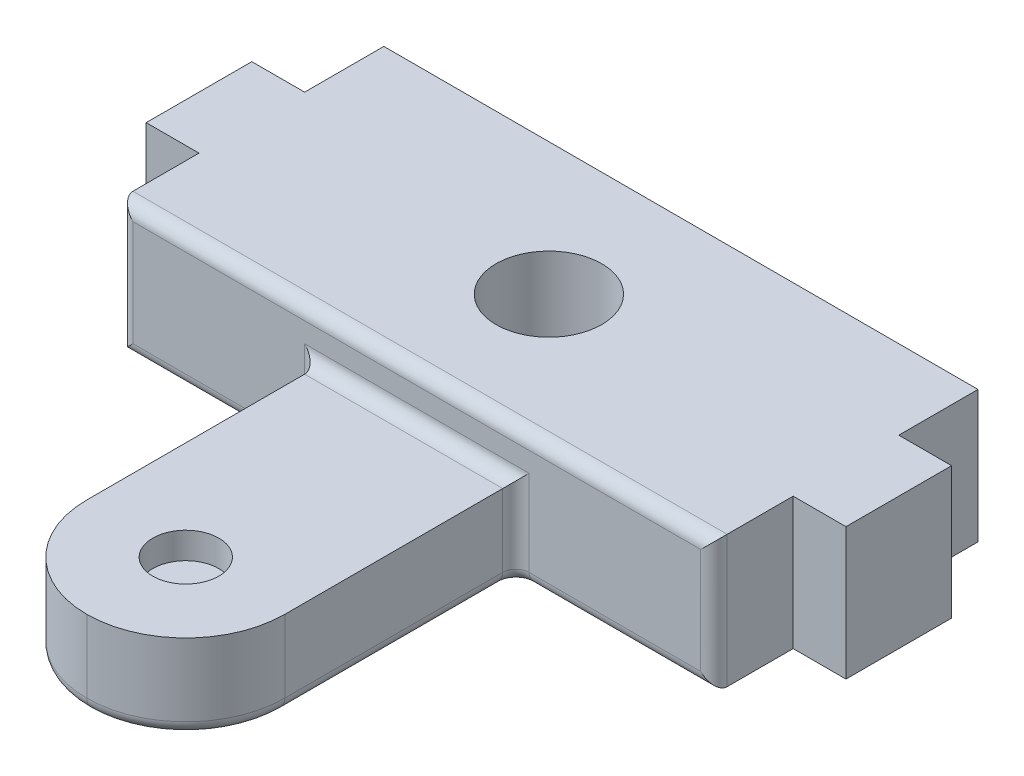
from build123d import *

# Parameters (mm, degrees)
AUFSATZ_LINEAR_AUSTRAGEN1_DEPTH      = 50
AUFSATZ_LINEAR_AUSTRAGEN1_DEPTH_BACK = 50
SKIZZE4_R                            = 40
SCHNITT_LINEAR_AUSTRAGEN1_DEPTH      = 100
SKIZZE5_W                            = 150
SKIZZE5_H                            = 100
AUFSATZ_LINEAR_AUSTRAGEN2_DEPTH      = 250
VERRUNDUNG2_R                        = 75
SCHNITT_LINEAR_AUSTRAGEN3_REACH      = 492.51
SKIZZE8_W                            = 120
SKIZZE8_H                            = 35
SKIZZE9_R                            = 25
SCHNITT_LINEAR_AUSTRAGEN4_DEPTH      = 20
SKIZZE10_W                           = 150
SKIZZE10_H                           = 130
SCHNITT_LINEAR_AUSTRAGEN5_DEPTH      = 35
VERRUNDUNG3_R                        = 10


with BuildPart() as part:
    # Skizze3 → Aufsatz-Linear austragen1 (new, two sides: drawn at the far end of the back side and taken through both)
    with BuildSketch(Plane(origin=(0, 0, 0), x_dir=(1, 0, 0), z_dir=(0, 1, 0)).offset(-AUFSATZ_LINEAR_AUSTRAGEN1_DEPTH_BACK)):
        Polygon((-265, -40), (-265, 40), (-225, 40), (-225, 100), (225, 100), (225, 40), (265, 40), (265, -40), (225, -40), (225, -100), (-225, -100), (-225, -40), align=None)
    extrude(amount=AUFSATZ_LINEAR_AUSTRAGEN1_DEPTH + AUFSATZ_LINEAR_AUSTRAGEN1_DEPTH_BACK)

    # Skizze4 → Schnitt-Linear austragen1 (cut)
    with BuildSketch(Plane(origin=(0, 50, 0), x_dir=(1, 0, 0), z_dir=(0, 1, 0))):
        with Locations(Location((0, 0, 0), (0, 0, 270))):
            Circle(SKIZZE4_R)
    extrude(amount=-SCHNITT_LINEAR_AUSTRAGEN1_DEPTH, mode=Mode.SUBTRACT)

    # Skizze5 → Aufsatz-Linear austragen2 (add)
    with BuildSketch(Plane.XY.offset(100)):
        Rectangle(SKIZZE5_W, SKIZZE5_H)
    extrude(amount=AUFSATZ_LINEAR_AUSTRAGEN2_DEPTH)

    # Verrundung2
    verrundung2_edges = [part.edges().sort_by_distance(p)[0] for p in [
        (-75, 0, 350),
        (75, 0, 350),
    ]]
    fillet(verrundung2_edges, radius=VERRUNDUNG2_R - 0.0001)  # a hair under: the kernel refuses the full size

    # Schnitt-Linear austragen3: up to this face of the body (flat: up to its plane)
    schnitt_linear_austragen3_end = Plane(part.part.faces().sort_by_distance((-75, 0, 187.50005))[0])
    # Skizze8 → Schnitt-Linear austragen3 (cut, up to the picked face)
    with BuildSketch(Plane(origin=(75, 0, 0), x_dir=(0, 0, -1), z_dir=(1, 0, 0)), mode=Mode.PRIVATE) as schnitt_linear_austragen3_sk1:
        with Locations((-290, 32.5)):
            Rectangle(SKIZZE8_W, SKIZZE8_H)
    schnitt_linear_austragen3_tool1 = split(extrude(schnitt_linear_austragen3_sk1.sketch, amount=-SCHNITT_LINEAR_AUSTRAGEN3_REACH, mode=Mode.PRIVATE), bisect_by=schnitt_linear_austragen3_end, keep=Keep.BOTH, mode=Mode.PRIVATE)
    add(schnitt_linear_austragen3_tool1.solids().sort_by(Axis((75, 32.5, 290), (-1, 0, 0)))[0], mode=Mode.SUBTRACT)

    # Skizze9 → Schnitt-Linear austragen4 (cut)
    with BuildSketch(Plane(origin=(0, 15, 0), x_dir=(1, 0, 0), z_dir=(0, 1, 0))):
        with Locations(Location((0, -275, 0), (0, 0, 180))):
            Circle(SKIZZE9_R)
    extrude(amount=-SCHNITT_LINEAR_AUSTRAGEN4_DEPTH, mode=Mode.SUBTRACT)

    # Skizze10 → Schnitt-Linear austragen5 (cut)
    with BuildSketch(Plane(origin=(0, 50, 0), x_dir=(1, 0, 0), z_dir=(0, 1, 0))):
        with Locations((0, -165)):
            Rectangle(SKIZZE10_W, SKIZZE10_H)
    extrude(amount=-SCHNITT_LINEAR_AUSTRAGEN5_DEPTH, mode=Mode.SUBTRACT)

    # Verrundung3
    verrundung3_edges = [part.edges().sort_by_distance(p)[0] for p in [
        (-75, -17.5, 100),
        (0, 15, 100),
        (-150, -50, 100),
        (225, 0, 100),
        (-225, 0, 100),
        (0, 50, 100),
        (150, -50, 100),
        (75, -17.5, 100),
        (75, -50, 187.50005),
        (-75, -50, 187.50005),
        (53.033037878, -50, 328.033037878),
        (-53.033037878, -50, 328.033037878),
    ]]
    fillet(verrundung3_edges, radius=VERRUNDUNG3_R)


solid = part.part
